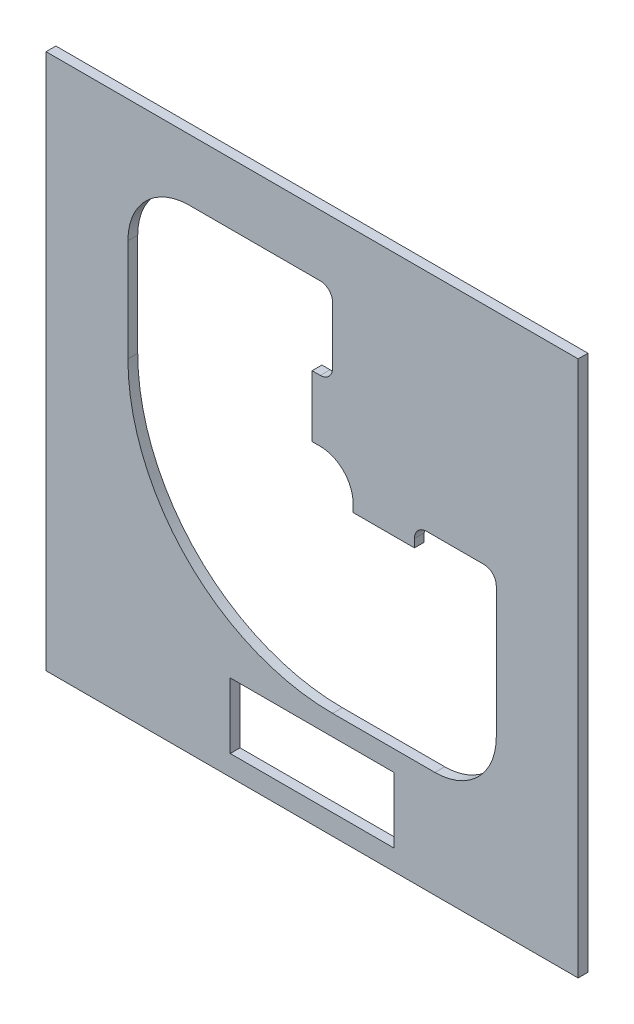
from build123d import *

# Parameters (mm, degrees)
BOSS_EXTRUDE1_DEPTH = 0.12
FILLET2_R           = 1.5
FILLET3_R           = 5
BOSS_EXTRUDE2_DEPTH = 0.12
SKETCH5_W           = 1
SKETCH5_H           = 13.1
SKETCH5_W_2         = 2.922992305
SKETCH5_H_2         = 2.818599723
BOSS_EXTRUDE3_DEPTH = 0.12
FILLET5_R           = 0.3
FILLET6_R           = 0.8


with BuildPart() as part:
    # Sketch1 → Boss-Extrude1 (new, symmetric)
    with BuildSketch(Plane.XY):
        Polygon((0, 0), (-11, 0), (-11, 10.5), (-11, 11), (0, 11), (0, 10.5), align=None)
        Polygon((-1, 0.5), (-1, 5.5), (-3, 5.5), (-3, 5), (-4.5, 5), (-4.5, 6), (-5.5, 6), (-5.5, 7.5), (-5, 7.5), (-5, 9.5), (-10, 9.5), (-10, 0.5), align=None, mode=Mode.SUBTRACT)
    extrude(amount=BOSS_EXTRUDE1_DEPTH, both=True)

    # Fillet2
    fillet2_edges = [part.edges().sort_by_distance(p)[0] for p in [
        (-10, 9.5, 0),
        (-1, 0.5, 0),
    ]]
    fillet(fillet2_edges, radius=FILLET2_R)

    # Fillet3
    fillet3_edges = [part.edges().sort_by_distance(p)[0] for p in [
        (-10, 0.5, 0),
    ]]
    fillet(fillet3_edges, radius=FILLET3_R)

    # Sketch4 → Boss-Extrude2 (add, symmetric)
    with BuildSketch(Plane.XY):
        Polygon((0, 0), (0, -2.1), (-11, -2.1), (-11, 0), (-7.5, 0), (-7.5, -1.6), (-3.5, -1.6), (-3.5, 0), align=None)
    extrude(amount=BOSS_EXTRUDE2_DEPTH, both=True)

    # Sketch5 → Boss-Extrude3 (add, symmetric)
    with BuildSketch(Plane.XY):
        with Locations((-11.5, 4.45)):
            Rectangle(SKETCH5_W, SKETCH5_H)
        with Locations((0.5, 4.45)):
            Rectangle(SKETCH5_W, SKETCH5_H)
        with Locations((-1.978875572, 8.357232245)):
            Rectangle(SKETCH5_W_2, SKETCH5_H_2)
    extrude(amount=BOSS_EXTRUDE3_DEPTH, both=True)

    # Fillet5
    fillet5_edges = [part.edges().sort_by_distance(p)[0] for p in [
        (-1, 5.5, 0),
        (-3, 5.5, 0),
        (-5, 7.5, 0),
        (-5, 9.5, 0),
    ]]
    fillet(fillet5_edges, radius=FILLET5_R)

    # Fillet6
    fillet6_edges = [part.edges().sort_by_distance(p)[0] for p in [
        (-4.5, 6, 0),
    ]]
    fillet(fillet6_edges, radius=FILLET6_R)


solid = part.part
